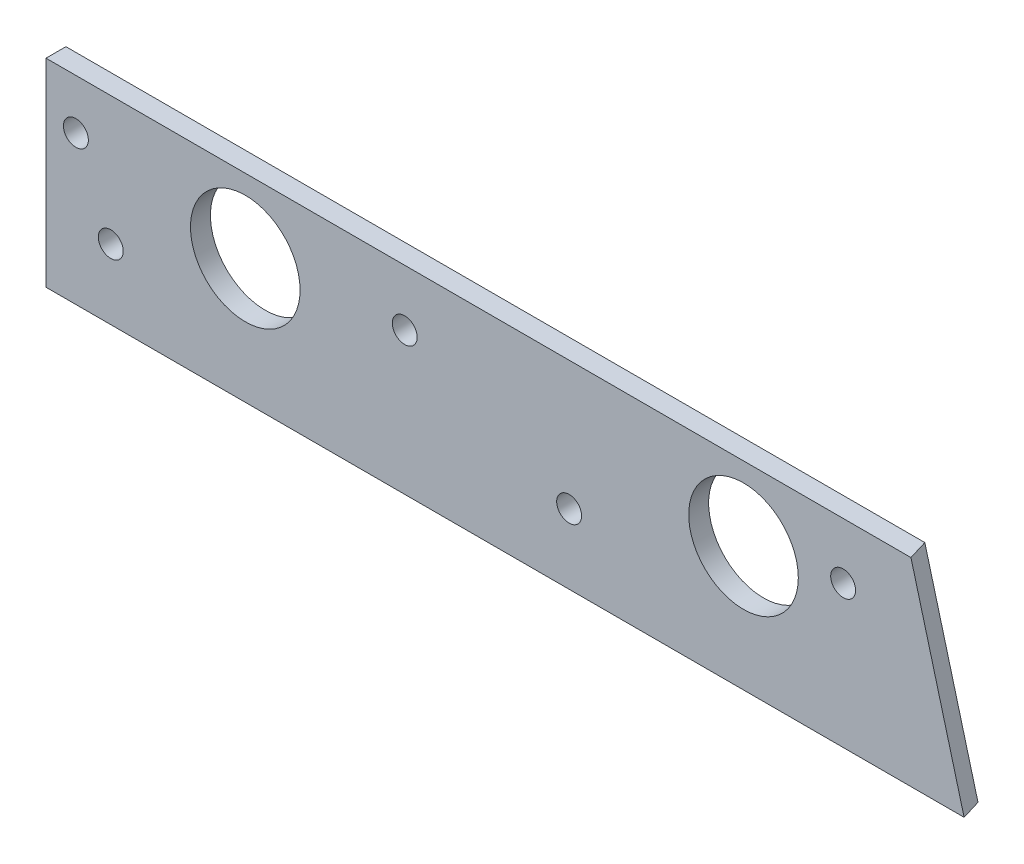
from build123d import *

# Parameters (mm, degrees)
SKETCH2_R           = 11
SKETCH2_R_2         = 2.5
BOSS_EXTRUDE1_DEPTH = 4
CHAMFER1_SIZE       = 6.82619664
CHAMFER1_SIZE_2     = 2


with BuildPart() as part:
    # Sketch2 → Boss-Extrude1 (new body)
    with BuildSketch(Plane.XY):
        Polygon((80.138070711, -30), (69.467402807, 9.823474767), (-105, 9.823474767), (-105, -30), align=None)
        with Locations((35, -5)):
            Circle(SKETCH2_R, mode=Mode.SUBTRACT)
        with Locations((-65, -5)):
            Circle(SKETCH2_R, mode=Mode.SUBTRACT)
        with Locations((-92, -16)):
            Circle(SKETCH2_R_2, mode=Mode.SUBTRACT)
        with Locations((0, -16)):
            Circle(SKETCH2_R_2, mode=Mode.SUBTRACT)
        with Locations((-99, -0.176525233)):
            Circle(SKETCH2_R_2, mode=Mode.SUBTRACT)
        with Locations((-33, -1.453163789)):
            Circle(SKETCH2_R_2, mode=Mode.SUBTRACT)
        with Locations((55, -1.453163789)):
            Circle(SKETCH2_R_2, mode=Mode.SUBTRACT)
    extrude(amount=BOSS_EXTRUDE1_DEPTH)

    # Chamfer1
    # the kernel refuses this chamfer: 6.82619664, 2 mm, written as the material it takes off along each edge
    with BuildSketch(Plane(origin=(84.724761545, -47.117763232, 0), x_dir=(0.010461335179728238, 0.0028031063131594876, 0.9999413498107049), z_dir=(-0.25881904510252185, 0.965925826289068, 0))) as chamfer1_piece_1:
        Polygon((CHAMFER1_SIZE * 0.999941349797, -CHAMFER1_SIZE * 0.0108303711267), (-CHAMFER1_SIZE_2 * 0.0108303711269, -CHAMFER1_SIZE_2 * 0.999941349811), (0, 0), align=None)
    extrude(amount=76.67151992, mode=Mode.SUBTRACT)


solid = part.part
